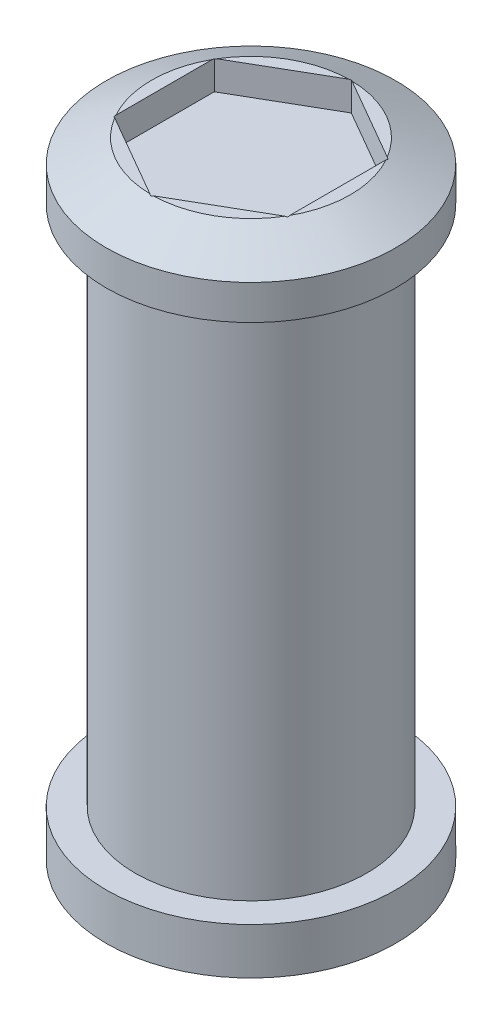
from build123d import *

# Parameters (mm, degrees)
SKETCH1_R           = 50.8
BOSS_EXTRUDE1_DEPTH = 228.6
SKETCH2_R           = 63.5
BOSS_EXTRUDE2_DEPTH = 25.4
BOSS_EXTRUDE3_START = 25.4
SKETCH3_R           = 63.5
BOSS_EXTRUDE3_DEPTH = 25.4
CUT_EXTRUDE2_DEPTH  = 12.7
CHAMFER2_SIZE       = 10.16
CHAMFER2_SIZE_2     = 19.940122736
SKETCH5_R           = 38.1
CUT_EXTRUDE5_DEPTH  = 12.7
CHAMFER3_SIZE       = 5.08
CHAMFER3_SIZE2      = 17.716065375
SKETCH6_R           = 31.75
BOSS_EXTRUDE6_DEPTH = 12.7


with BuildPart() as part:
    # Sketch1 → Boss-Extrude1 (new body)
    with BuildSketch(Plane(origin=(0, 0, 0), x_dir=(1, 0, 0), z_dir=(0, 1, 0))):
        with Locations(Location((0, 0, 0), (0, 0, 270))):
            Circle(SKETCH1_R)
    extrude(amount=BOSS_EXTRUDE1_DEPTH)

    # Sketch2 → Boss-Extrude2 (add)
    with BuildSketch(Plane(origin=(0, 228.6, 0), x_dir=(1, 0, 0), z_dir=(0, 1, 0))):
        with Locations(Location((0, 0, 0), (0, 0, 270))):
            Circle(SKETCH2_R)
    extrude(amount=BOSS_EXTRUDE2_DEPTH)

    # Sketch3 → Boss-Extrude3 (add)
    with BuildSketch(Plane.XZ.offset(BOSS_EXTRUDE3_START)):
        with Locations(Location((0, 0, 0), (0, 0, 90))):
            Circle(SKETCH3_R)
    extrude(amount=-BOSS_EXTRUDE3_DEPTH)

    # Sketch4 → Cut-Extrude2 (cut)
    with BuildSketch(Plane(origin=(0, 254, 0), x_dir=(1, 0, 0), z_dir=(0, 1, 0))):
        Polygon((0, 43.994090512), (-38.1, 21.997045256), (-38.1, -21.997045256), (0, -43.994090512), (38.1, -21.997045256), (38.1, 21.997045256), align=None)
    extrude(amount=-CUT_EXTRUDE2_DEPTH, mode=Mode.SUBTRACT)

    # Chamfer2
    # the kernel refuses this chamfer: 19.940122736, 10.16 mm, written as the material it takes off along each edge
    with BuildSketch(Plane(origin=(0, 254, 0), x_dir=(0, 0, 1), z_dir=(-1, 0, 0))) as chamfer2_piece_1:
        Polygon((63.5, -CHAMFER2_SIZE), (63.5 - CHAMFER2_SIZE_2, 0), (63.5, 0), align=None)
    revolve(axis=Axis((0, 254, 0), (0, 1, 0)), mode=Mode.SUBTRACT)

    # Sketch5 → Cut-Extrude5 (cut)
    with BuildSketch(Plane.XZ.offset(25.4)):
        Circle(SKETCH5_R)
        with BuildLine():
            Line((19.049999468, 32.995568191), (0, 43.994090512))
            Line((0, 43.994090512), (-19.04999937, 32.995568248))
            ThreePointArc((-19.04999937, 32.995568248), (5.7e-08, 38.1), (19.049999468, 32.995568191))
        make_face()
        with BuildLine():
            Line((38.1, 21.997045256), (19.049999468, 32.995568191))
            ThreePointArc((19.049999468, 32.995568191), (32.995567731, 19.050000266), (38.1, 0))
            Line((38.1, 0), (38.1, 21.997045256))
        make_face()
        with BuildLine():
            ThreePointArc((-38.1, -1.79e-07), (-32.995567747, 19.050000238), (-19.04999937, 32.995568248))
            Line((-19.04999937, 32.995568248), (-38.1, 21.997045256))
            Line((-38.1, 21.997045256), (-38.1, -1.79e-07))
        make_face()
        with BuildLine():
            ThreePointArc((-19.049999051, -32.995568432), (-32.995567566, -19.050000552), (-38.1, -1.79e-07))
            Line((-38.1, -1.79e-07), (-38.1, -21.997045256))
            Line((-38.1, -21.997045256), (-19.049999051, -32.995568432))
        make_face()
        with BuildLine():
            Line((38.1, -21.997045256), (38.1, 0))
            ThreePointArc((38.1, 0), (32.995567731, -19.050000266), (19.049999468, -32.995568191))
            Line((19.049999468, -32.995568191), (38.1, -21.997045256))
        make_face()
        with BuildLine():
            ThreePointArc((19.049999468, -32.995568191), (2.4e-07, -38.1), (-19.049999051, -32.995568432))
            Line((-19.049999051, -32.995568432), (0, -43.994090512))
            Line((0, -43.994090512), (19.049999468, -32.995568191))
        make_face()
    extrude(amount=-CUT_EXTRUDE5_DEPTH, mode=Mode.SUBTRACT)

    # Chamfer3
    chamfer3_edges = [part.edges().sort_by_distance(p)[0] for p in [
        (0, -25.4, -63.5),
    ]]
    chamfer3_side = [part.faces().sort_by_distance(p)[0] for p in [
        (0, -12.7, -63.5),
    ]]
    chamfer(chamfer3_edges, length=CHAMFER3_SIZE, length2=CHAMFER3_SIZE2, reference=chamfer3_side[0])

    # Sketch6 → Boss-Extrude6 (add)
    with BuildSketch(Plane.XZ.offset(12.7)):
        with Locations(Location((0, 0, 0), (0, 0, 270))):
            Circle(SKETCH6_R)
    extrude(amount=BOSS_EXTRUDE6_DEPTH)


solid = part.part
